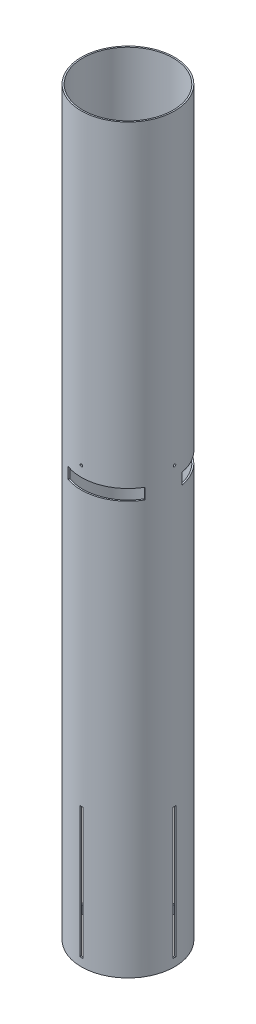
from build123d import *

# Parameters (mm, degrees)
SKETCH1_R           = 51.1048
SKETCH1_R_2         = 49.53
BOSS_EXTRUDE1_DEPTH = 812.8
CUT_EXTRUDE1_DEPTH  = 817.00688794
CIRPATTERN1_COUNT   = 4
CUT_EXTRUDE2_DEPTH  = 817.00688794
CIRPATTERN2_COUNT   = 4
SKETCH3_R           = 3.175
CUT_EXTRUDE3_DEPTH  = 817.006888053
CUT_EXTRUDE4_START  = -12.065
CUT_EXTRUDE4_DEPTH  = 12.065
CIRPATTERN3_COUNT   = 3


with BuildPart() as part:
    # Sketch1 → Boss-Extrude1 (new body)
    with BuildSketch(Plane(origin=(0, 0, 0), x_dir=(1, 0, 0), z_dir=(0, 1, 0))):
        Circle(SKETCH1_R)
        Circle(SKETCH1_R_2, mode=Mode.SUBTRACT)
    extrude(amount=BOSS_EXTRUDE1_DEPTH)

    # Sketch2 → Cut-Extrude1 (cut, through all)
    with BuildSketch(Plane(origin=(0, 0, 0), x_dir=(0, 0, -1), z_dir=(1, 0, 0))):
        Polygon((0, 8.89), (1.5875, 8.89), (1.5875, 152.4), (-1.5875, 152.4), (-1.5875, 8.89), align=None)
    cut_extrude1 = extrude(amount=-CUT_EXTRUDE1_DEPTH, mode=Mode.SUBTRACT)

    # CirPattern1: Cut-Extrude1 ×4 about axis
    cirpattern1_axis = Axis((0, 0, 0), (0, 1, 0))
    for i in range(1, CIRPATTERN1_COUNT):
        add(cut_extrude1.rotate(cirpattern1_axis, i * 360 / CIRPATTERN1_COUNT), mode=Mode.SUBTRACT)

    # Sketch2<3> → Cut-Extrude2 (cut, through all)
    with BuildSketch(Plane(origin=(0, 0, 0), x_dir=(0, 0, -1), z_dir=(1, 0, 0))):
        with BuildLine():
            ThreePointArc((0, 477.60255), (-0.956397277, 475.293602723), (1.35255, 476.25))
            ThreePointArc((1.35255, 476.25), (0.956397277, 477.206397277), (0, 477.60255))
        make_face()
    cut_extrude2 = extrude(amount=-CUT_EXTRUDE2_DEPTH, mode=Mode.SUBTRACT)

    # CirPattern2: Cut-Extrude2 ×4 about axis
    cirpattern2_axis = Axis((0, 812.8, 0), (0, -1, 0))
    for i in range(1, CIRPATTERN2_COUNT):
        add(cut_extrude2.rotate(cirpattern2_axis, i * 360 / CIRPATTERN2_COUNT), mode=Mode.SUBTRACT)

    # Sketch3 → Cut-Extrude3 (cut, through all)
    with BuildSketch(Plane(origin=(0, 0, 0), x_dir=(0.7071067811865477, 0, -0.7071067811865475), z_dir=(0.7071067811865475, 0, 0.7071067811865477))):
        with Locations((0, 127)):
            Circle(SKETCH3_R)
    extrude(amount=-CUT_EXTRUDE3_DEPTH, mode=Mode.SUBTRACT)

    # Sketch7 → Cut-Extrude4 (cut)
    with BuildSketch(Plane(origin=(0, 464.82, 0), x_dir=(1, 0, 0), z_dir=(0, 1, 0)).offset(CUT_EXTRUDE4_START)):
        with BuildLine():
            Line((-44.258055055, -25.5524), (-42.894238249, -24.765))
            ThreePointArc((-42.894238249, -24.765), (-48.777528007, 8.60079424), (-31.837270308, 37.942181268))
            Line((-31.837270308, 37.942181268), (-32.849532236, 39.148548057))
            ThreePointArc((-32.849532236, 39.148548057), (-46.026790738, 22.208897258), (-51.086898433, 1.35255))
            ThreePointArc((-51.086898433, 1.35255), (-51.1048, 0), (-51.086898433, -1.35255))
            ThreePointArc((-51.086898433, -1.35255), (-49.184074902, -13.87902587), (-44.258055055, -25.5524))
        make_face()
    cut_extrude4 = extrude(amount=CUT_EXTRUDE4_DEPTH, mode=Mode.SUBTRACT)

    # CirPattern3: Cut-Extrude4 ×3 about axis
    cirpattern3_axis = Axis((0, 812.8, 0), (0, -1, 0))
    for i in range(1, CIRPATTERN3_COUNT):
        add(cut_extrude4.rotate(cirpattern3_axis, i * 360 / CIRPATTERN3_COUNT), mode=Mode.SUBTRACT)


solid = part.part
